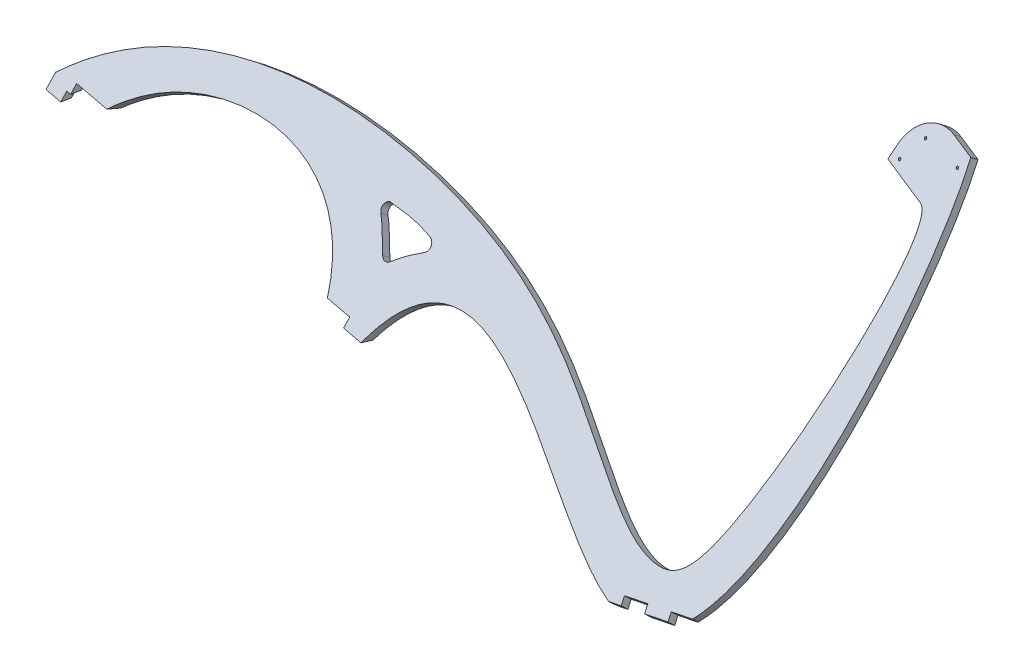
from build123d import *

# Parameters (mm, degrees)
BOSS_EXTRUDE2_DEPTH = 12
FILLET1_R           = 60
FILLET2_START       = 107
FILLET2_DEPTH       = 14
CUT_EXTRUDE1_DEPTH  = 40
SKETCH15_W          = 243.349081357
SKETCH15_H          = 73.199970684
CUT_EXTRUDE2_DEPTH  = 30
CUT_EXTRUDE3_DEPTH  = 30
CUT_EXTRUDE6_DEPTH  = 80
CUT_EXTRUDE7_DEPTH  = 20
SKETCH18_W          = 73.303280007
SKETCH18_H          = 56.851278382
CUT_EXTRUDE8_DEPTH  = 20
SKETCH20_R          = 2
CUT_EXTRUDE9_DEPTH  = 30


with BuildPart() as part:
    # Sketch1 → Boss-Extrude2 (new body)
    with BuildSketch(Plane(origin=(17.499621279, -61.61379575, -87.064736905), x_dir=(-0.9876187232583227, -0.08713233745500036, -0.1304500411622347), z_dir=(0.15682197091950426, -0.5696616125193356, -0.806779100286313))):
        with BuildLine():
            Line((-225.314186924, 126.926663041), (-260.740585668, 123.149613081))
            add(Edge.make_bspline(
                [(-1026.323879432, 684.844818563), (-1056.508620936, 520.531980219), (-1000.663393604, -421.933972897), (-393.99395985, 393.213192581), (-260.740585668, 123.149613081)],
                knots=[0, 0, 0, 0, 0.513112856, 1, 1, 1, 1], degree=3))
            Line((-1026.323879432, 684.844818563), (-924.66213896, 715.130872894))
            Line((-924.66213896, 715.130872894), (-906.380351044, 631.727592427))
            Line((-906.380351044, 631.727592427), (-982.273707999, 609.118198555))
            add(Edge.make_bspline(
                [(-982.273707999, 609.118198555), (-1029.609554551, 598.292970699), (-938.617703021, 119.167667524), (-844.184782333, 81.542703278), (-750.458621117, 111.473413902), (-542.551524378, 265.885684428), (-159.681707748, 379.44898302), (217.426786783, 343.79243143), (363.558616705, 198.074996535)],
                knots=[0, 0, 0, 0, 0.220807253, 0.303232962, 0.390141586, 0.497709147, 0.653993698, 1, 1, 1, 1], degree=3))
            Line((363.558616705, 198.074996535), (366.12652525, 175.300757751))
            Line((366.12652525, 175.300757751), (336.399459375, 172.131352535))
            Line((336.399459375, 172.131352535), (334.763496232, 186.640364288))
            Line((334.763496232, 186.640364288), (326.987671541, 185.81133059))
            Line((326.987671541, 185.81133059), (325.439765891, 200.329730753))
            Line((325.439765891, 200.329730753), (264.505814277, 193.833146633))
            add(Edge.make_bspline(
                [(-182.219308581, 146.204734846), (-137.559580385, 288.661474118), (94.016310829, 311.70107985), (234.600101619, 223.236560094), (264.505814277, 193.833146633)],
                knots=[0, 0, 0, 0, 0.721610275, 0.964477135, 0.964477135, 0.964477135, 0.964477135], degree=3))
            Line((-182.219308581, 146.204734846), (-227.328962426, 141.395287025))
            Line((-227.328962426, 141.395287025), (-225.314186924, 126.926663041))
        make_face()
    extrude(amount=BOSS_EXTRUDE2_DEPTH)

    # Fillet1
    fillet1_edges = [part.edges().sort_by_distance(p)[0] for p in [
        (934.526039661, 599.975181594, -383.393624525),
    ]]
    fillet(fillet1_edges, radius=FILLET1_R)

    # Fillet2: read off the stored shape, not the designer's step
    # Fillet2 outline → Fillet2 (cut)
    with BuildSketch(Plane(origin=(0, 0, 0), x_dir=(0.9876268877652746, 0.09045466252402906, 0.12810575549420786), z_dir=(0.15682197091950398, -0.5696616125193359, -0.8067791002863127)).offset(FILLET2_START)):
        with BuildLine():
            Line((985.29869684, -605.006419446), (984.679984545, -605.19348245))
            ThreePointArc((984.679984545, -605.19348245), (985.144645739, -605.057078974), (985.611448185, -604.928193716))
            add(Edge.make_bspline(
                [(985.29869684, -605.006419446), (985.403511582, -604.982000475), (985.507761576, -604.955923141), (985.611448185, -604.928193716)],
                knots=[0, 0, 0, 0, 0.000489388, 0.000489388, 0.000489388, 0.000489388], degree=3))
        make_face()
    extrude(amount=FILLET2_DEPTH, mode=Mode.SUBTRACT)

    # Sketch14 → Cut-Extrude1 (cut)
    with BuildSketch(Plane(origin=(10.924748362, -56.003662592, 56.202958057), x_dir=(0.9906531193515884, 0.09596945202116303, -0.09693431486179331), z_dir=(0.13640457152113114, -0.6992523165335648, 0.7017406862157701))):
        with BuildLine():
            Line((816.745225196, 27.027846805), (821.031545061, 3.716316265))
            Line((821.031545061, 3.716316265), (860.392366151, 10.839434694))
            Line((860.392366151, 10.839434694), (856.085734131, 34.261434692))
            Line((856.085734131, 34.261434692), (895.426237694, 41.495021592))
            Line((895.426237694, 41.495021592), (899.753181867, 17.962552151))
            Line((899.753181867, 17.962552151), (940.83853488, 25.397758712))
            Line((940.83853488, 25.397758712), (940.83853488, 74.052404239))
            add(Edge.make_bspline(
                [(940.83853488, 74.052404239), (944.360073523, 83.411367299), (947.237769976, 96.512286129), (947.869469368, 114.247238703), (948.418512599, 177.427769683), (946.365597769, 304.887713477), (857.900151582, 497.384495092), (839.016001274, 527.501036585)],
                knots=[0.690680725, 0.690680725, 0.690680725, 0.690680725, 0.721643614, 0.729568425, 0.737326286, 0.884725643, 1, 1, 1, 1], degree=3))
            Line((839.016001274, 527.501036585), (827.90339085, 545.330615201))
            Line((827.90339085, 545.330615201), (696.201920996, 529.535827173))
            ThreePointArc((696.201920996, 529.535827173), (688.851252251, 524.807368286), (688.025432599, 516.106295))
            Line((688.025432599, 516.106295), (698.612717373, 487.77646612))
            Line((698.612717373, 487.77646612), (780.078976085, 496.777582217))
            ThreePointArc((780.078976085, 496.777582217), (796.166394528, 494.094703125), (808.472788767, 483.391641264))
            add(Edge.make_bspline(
                [(808.472788767, 483.391641264), (871.139978718, 387.673626382), (900.871084058, 266.725679336), (891.930258724, 117.543221228), (838.268420879, 60.312434736), (474.855612311, 278.547280884), (312.427698208, 323.51076817), (174.371462994, 354.200668669), (-202.01122553, 404.142437678), (-347.344381598, 237.316919015), (-354.496277138, 221.335645488)],
                knots=[0.007747817, 0.007747817, 0.007747817, 0.007747817, 0.151161833, 0.162645521, 0.216715123, 0.325184102, 0.582296246, 0.642884213, 0.93106377, 0.98764896, 0.98764896, 0.98764896, 0.98764896], degree=3))
            Line((-354.496277138, 221.335645488), (-356.139928012, 209.4041265))
            Line((-356.139928012, 209.4041265), (-326.213902057, 205.591674817))
            Line((-326.213902057, 205.591674817), (-323.996441395, 221.959984851))
            Line((-323.996441395, 221.959984851), (-316.453521989, 220.938124499))
            Line((-316.453521989, 220.938124499), (-314.200039957, 237.572328291))
            Line((-314.200039957, 237.572328291), (-257.821192962, 229.934528473))
            add(Edge.make_bspline(
                [(-257.821192962, 229.934528473), (-243.112682492, 243.982376682), (-165.28047707, 289.294571743), (-13.243998454, 338.791774985), (155.769740704, 256.205723335), (181.17074091, 170.463065464)],
                knots=[0.024400531, 0.024400531, 0.024400531, 0.024400531, 0.127271663, 0.423150465, 0.944536648, 0.944536648, 0.944536648, 0.944536648], degree=3))
            Line((181.17074091, 170.463065464), (231.931120118, 163.586415187))
            Line((231.931120118, 163.586415187), (229.677638086, 146.952211395))
            Line((229.677638086, 146.952211395), (268.023009054, 141.757456926))
            Line((268.023009054, 141.757456926), (270.879361001, 153.829472699))
            add(Edge.make_bspline(
                [(270.879361001, 153.829472699), (347.27919726, 247.174817808), (551.371828268, 165.37161676), (732.220966778, 41.975516652), (792.601362753, 22.588485047)],
                knots=[0, 0, 0, 0, 0.313933208, 0.498958302, 0.498958302, 0.498958302, 0.498958302], degree=3))
            Line((792.601362753, 22.588485047), (816.745225196, 27.027846805))
        make_face()
    extrude(amount=CUT_EXTRUDE1_DEPTH, mode=Mode.SUBTRACT)

    # Sketch15 → Cut-Extrude2 (cut)
    with BuildSketch(Plane(origin=(12.56160322, -64.39469039, 64.623846292), x_dir=(0.9906532095994115, 0.09635673173703921, -0.09654842598064883), z_dir=(0.13640457152113103, -0.6992523165335651, 0.7017406862157699))):
        with Locations((853.671537345, 36.599985342)):
            Rectangle(SKETCH15_W, SKETCH15_H)
    extrude(amount=CUT_EXTRUDE2_DEPTH, mode=Mode.SUBTRACT)

    # Sketch13 → Cut-Extrude3 (cut)
    with BuildSketch(Plane(origin=(18.832021179, -68.408013806, -96.882350184), x_dir=(-0.9876268799564254, -0.09055738625213265, -0.12803322140256676), z_dir=(0.15682197091950428, -0.5696616125193414, -0.8067791002863087))):
        with BuildLine():
            ThreePointArc((-235.875243917, 221.376032144), (-242.806313029, 217.068083469), (-250.639035105, 219.358630496))
            add(Edge.make_bspline(
                [(-295.39678015, 250.338719745), (-282.086268482, 242.948134721), (-266.885842968, 232.786871043), (-252.889672705, 221.272877153), (-250.639035105, 219.358630496)],
                knots=[0.719716426, 0.719716426, 0.719716426, 0.719716426, 0.796870109, 0.81192059, 0.81192059, 0.81192059, 0.81192059], degree=3))
            ThreePointArc((-295.39678015, 250.338719745), (-300.463570949, 260.33483402), (-293.069938504, 268.756761878))
            add(Edge.make_bspline(
                [(-293.069938504, 268.756761878), (-292.494716797, 268.907028556), (-261.912337425, 276.806670513), (-239.792856502, 277.447606801), (-213.097438231, 278.616283673)],
                knots=[0.445827483, 0.445827483, 0.445827483, 0.445827483, 0.448340488, 0.580052411, 0.580052411, 0.580052411, 0.580052411], degree=3))
            ThreePointArc((-213.097438231, 278.616283673), (-203.524882021, 272.693805779), (-205.527490584, 261.616841585))
            add(Edge.make_bspline(
                [(-235.875243917, 221.376032144), (-232.799100283, 225.927060905), (-220.158550029, 243.221396018), (-212.849668845, 254.16556821), (-205.527490584, 261.616841585)],
                knots=[0.147762383, 0.147762383, 0.147762383, 0.147762383, 0.170979331, 0.239181025, 0.239181025, 0.239181025, 0.239181025], degree=3))
        make_face()
    extrude(amount=-CUT_EXTRUDE3_DEPTH, mode=Mode.SUBTRACT)

    # Sketch16 → Cut-Extrude6 (cut)
    with BuildSketch(Plane(origin=(0, 73.748863914, 0), x_dir=(1, 0, 0), z_dir=(0, 1, 0))):
        with BuildLine():
            Line((-374.54339363, 166.325225336), (-362.402355561, 172.731381584))
            Line((-362.402355561, 172.731381584), (-356.802355561, 162.118182254))
            Line((-356.802355561, 162.118182254), (-383.335353884, 148.118182254))
            ThreePointArc((-383.335353884, 148.118182254), (-387.437238028, 138.598488701), (-391.259828936, 128.963250373))
            ThreePointArc((-391.259828936, 128.963250373), (-390.973082246, 121.181344036), (-385.191573873, 115.964596885))
            Line((-385.191573873, 115.964596885), (-384.719032078, 115.800541516))
            ThreePointArc((-384.719032078, 115.800541516), (-379.063848996, 110.84447414), (-378.460796753, 103.349140423))
            ThreePointArc((-378.460796753, 103.349140423), (-393.938932719, 2.69737241), (-378.460796753, -97.954395602))
            ThreePointArc((-378.460796753, -97.954395602), (-379.063848996, -105.449729319), (-384.719032078, -110.405796695))
            Line((-384.719032078, -110.405796695), (-385.191573873, -110.569852065))
            ThreePointArc((-385.191573873, -110.569852065), (-390.973082246, -115.786599216), (-391.259828936, -123.568505553))
            ThreePointArc((-391.259828936, -123.568505553), (-387.437238028, -133.20374388), (-383.335353884, -142.723437434))
            Line((-383.335353884, -142.723437434), (-356.802355561, -156.723437434))
            Line((-356.802355561, -156.723437434), (-362.402355561, -167.336636763))
            Line((-362.402355561, -167.336636763), (-374.54339363, -160.930480515))
            ThreePointArc((-374.54339363, -160.930480515), (-368.652500914, -171.824132499), (-362.385741774, -182.505986291))
            ThreePointArc((-362.385741774, -182.505986291), (-360.696778386, -184.584754792), (-358.516633221, -186.140660593))
            Line((-358.516633221, -186.140660593), (-321.069277524, -205.899565086))
            ThreePointArc((-321.069277524, -205.899565086), (-313.822319052, -214.695036315), (-306.280382382, -223.238917899))
            Line((-306.280382382, -223.238917899), (-297.69397759, -267.412141154))
            ThreePointArc((-297.69397759, -267.412141154), (-295.58180619, -270.60328404), (-291.831796696, -271.366232094))
            Line((-291.831796696, -271.366232094), (-262.253094318, -265.616714782))
            ThreePointArc((-262.253094318, -265.616714782), (-260.19448814, -265.648382248), (-258.323165273, -266.50687683))
            ThreePointArc((-258.323165273, -266.50687683), (-41.683525746, -331.857930836), (167.083205589, -244.565631281))
            Line((167.083205589, -244.565631281), (253.617977885, -165.464536575))
            ThreePointArc((253.617977885, -165.464536575), (254.78845558, -164.192124324), (255.722277938, -162.737123714))
            ThreePointArc((255.722277938, -162.737123714), (257.93135897, -158.465490076), (260.082454476, -154.164364517))
            Line((260.082454476, -154.164364517), (242.396194085, -157.602225279))
            Line((242.396194085, -157.602225279), (239.193245183, -141.124481642))
            Line((239.193245183, -141.124481642), (268.642060686, -135.40021178))
            ThreePointArc((268.642060686, -135.40021178), (274.873512464, -119.57078142), (280.340557291, -103.461365613))
            ThreePointArc((280.340557291, -103.461365613), (279.584629492, -95.714681082), (273.503415187, -90.856555864))
            Line((273.503415187, -90.856555864), (263.535345365, -88.051401542))
            ThreePointArc((263.535345365, -88.051401542), (276.059779871, 3.626114851), (263.027212679, 95.232777622))
            Line((263.027212679, 95.232777622), (234.412131626, 100.619240834))
            Line((234.412131626, 100.619240834), (242.581780625, 138.891913782))
            Line((242.581780625, 138.891913782), (245.630273417, 153.173306729))
            Line((245.630273417, 153.173306729), (265.189703404, 149.371338681))
            ThreePointArc((265.189703404, 149.371338681), (259.661991196, 161.020069511), (253.715808281, 172.460849245))
            Line((253.715808281, 172.460849245), (164.455412165, 252.337046087))
            ThreePointArc((164.455412165, 252.337046087), (-43.452986582, 337.339248858), (-258.323165273, 271.901621651))
            ThreePointArc((-258.323165273, 271.901621651), (-260.19448814, 271.043127069), (-262.253094318, 271.011459603))
            Line((-262.253094318, 271.011459603), (-291.831796696, 276.760976915))
            ThreePointArc((-291.831796696, 276.760976915), (-295.58180619, 275.99802886), (-297.69397759, 272.806885975))
            Line((-297.69397759, 272.806885975), (-306.280382382, 228.633662719))
            ThreePointArc((-306.280382382, 228.633662719), (-313.822319052, 220.089781136), (-321.069277524, 211.294309906))
            Line((-321.069277524, 211.294309906), (-358.516633221, 191.535405414))
            ThreePointArc((-358.516633221, 191.535405414), (-360.696778386, 189.979499612), (-362.385741774, 187.900731112))
            ThreePointArc((-362.385741774, 187.900731112), (-368.652500914, 177.21887732), (-374.54339363, 166.325225336))
        make_face()
    extrude(amount=-CUT_EXTRUDE6_DEPTH, mode=Mode.SUBTRACT)

    # Sketch17 → Cut-Extrude7 (cut)
    with BuildSketch(Plane(origin=(0, 61.748863914, 0), x_dir=(1, 0, 0), z_dir=(0, 1, 0))):
        with BuildLine():
            Line((-311.512684178, -236.213422387), (-318.023840473, -202.716427118))
            Line((-318.023840473, -202.716427118), (-348.409652264, -206.540924719))
            ThreePointArc((-348.409652264, -206.540924719), (-349.605191819, -202.716427118), (-351.539121662, -199.20700949))
            ThreePointArc((-351.539121662, -199.20700949), (-414.438932719, 2.69737241), (-351.539121662, 204.601754311))
            ThreePointArc((-351.539121662, 204.601754311), (-349.605191819, 208.111171939), (-348.409652264, 211.935669539))
            Line((-348.409652264, 211.935669539), (-319.024574093, 205.898429051))
            Line((-319.024574093, 205.898429051), (-312.369559119, 238.290402767))
            Line((-312.369559119, 238.290402767), (-309.534096977, 252.613204677))
            Line((-309.534096977, 252.613204677), (-338.880376024, 258.31754347))
            Line((-338.880376024, 258.31754347), (-336.501617456, 269.895681958))
            ThreePointArc((-336.501617456, 269.895681958), (-325.771486824, 285.738056153), (-306.981888468, 289.352958244))
            Line((-306.981888468, 289.352958244), (-288.333896548, 285.52167996))
            ThreePointArc((-288.333896548, 285.52167996), (-277.993426871, 285.580447943), (-268.561294541, 289.818802165))
            ThreePointArc((-268.561294541, 289.818802165), (19.608229089, 349.41136603), (253.958977243, 171.443181072))
            Line((253.958977243, 171.443181072), (303.114102429, 175.13377071))
            Line((303.114102429, 175.13377071), (325.428526537, 113.46564528))
            Line((325.428526537, 113.46564528), (280.799678322, 107.377485937))
            ThreePointArc((280.799678322, 107.377485937), (148.585042708, -285.944359886), (-266.364085774, -286.015384288))
            ThreePointArc((-266.364085774, -286.015384288), (-275.734957156, -281.868857252), (-285.982172396, -281.830169745))
            Line((-285.982172396, -281.830169745), (-306.550879635, -286.05606397))
            ThreePointArc((-306.550879635, -286.05606397), (-325.340477991, -282.441161879), (-336.070608623, -266.598787684))
            Line((-336.070608623, -266.598787684), (-337.75215489, -258.414192651))
            Line((-337.75215489, -258.414192651), (-308.309735276, -252.691166024))
            Line((-308.309735276, -252.691166024), (-311.512684178, -236.213422387))
        make_face()
    extrude(amount=-CUT_EXTRUDE7_DEPTH, mode=Mode.SUBTRACT)

    # Sketch18 → Cut-Extrude8 (cut)
    with BuildSketch(Plane.XZ.offset(-49.748863914)):
        with Locations((-323.667663902, -231.33054156)):
            Rectangle(SKETCH18_W, SKETCH18_H)
    extrude(amount=CUT_EXTRUDE8_DEPTH, mode=Mode.SUBTRACT)

    # Sketch20 → Cut-Extrude9 (cut)
    with BuildSketch(Plane(origin=(18.832021179, -68.408013806, -96.882350184), x_dir=(-0.9876268869795103, -0.09042207679967998, -0.12812876391503392), z_dir=(0.15682197091950434, -0.5696616125193377, -0.8067791002863115))):
        with Locations(Location((-1016.949770048, 662.176167367, 0), (0, 0, 89.997714468))):
            Circle(SKETCH20_R)
        with Locations(Location((-950.914391666, 671.510951506, 0), (0, 0, 89.997714468))):
            Circle(SKETCH20_R)
        with Locations(Location((-926.796393466, 635.087793996, 0), (0, 0, 89.997714468))):
            Circle(SKETCH20_R)
    extrude(amount=-CUT_EXTRUDE9_DEPTH, mode=Mode.SUBTRACT)


solid = part.part
